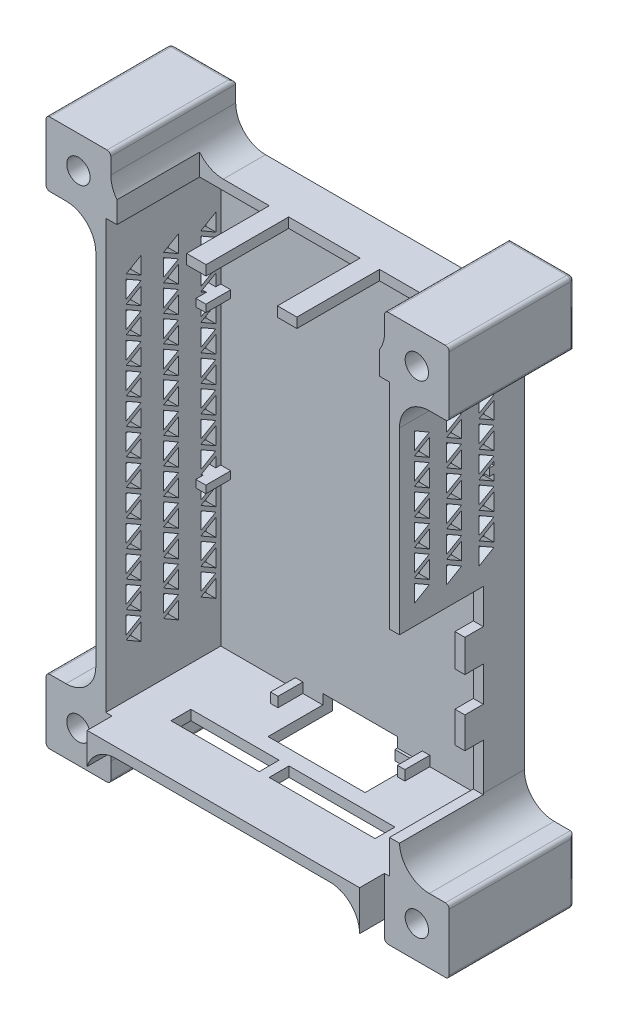
from build123d import *

# Parameters (mm, degrees)
SKETCH1_W            = 61
SKETCH1_H            = 90
BOSS_EXTRUDE1_DEPTH  = 2
SKETCH2_W            = 61
SKETCH2_H            = 90
SKETCH2_W_2          = 57
SKETCH2_H_2          = 86
BOSS_EXTRUDE2_DEPTH  = 6.6
SKETCH3_W            = 1.5
SKETCH3_H            = 2
SKETCH3_W_2          = 2
SKETCH3_H_2          = 1.5
BOSS_EXTRUDE3_DEPTH  = 5
SKETCH4_W            = 61
SKETCH4_H            = 90
SKETCH4_W_2          = 57
SKETCH4_H_2          = 86
BOSS_EXTRUDE4_DEPTH  = 16.5
SKETCH5_W            = 14.35
SKETCH5_H            = 16.6
SKETCH5_W_2          = 14
CUT_EXTRUDE1_DEPTH   = 2
SKETCH8_W            = 19.5
SKETCH8_H            = 10.5
SKETCH8_W_2          = 17.719958389
SKETCH8_H_2          = 4
SKETCH8_W_3          = 21.280041611
CUT_EXTRUDE3_DEPTH   = 2
CUT_EXTRUDE22_DEPTH  = 2
SKETCH10_W           = 61
SKETCH10_H           = 2
BOSS_EXTRUDE5_DEPTH  = 5
SKETCH20_W           = 13
SKETCH20_H           = 13
BOSS_EXTRUDE8_DEPTH  = 25.1
SKETCH25_W           = 13
SKETCH25_H           = 13
SKETCH25_W_2         = 0.25
CUT_EXTRUDE11_DEPTH  = 126.183904716
SKETCH26_W           = 1
SKETCH26_H           = 1
CUT_EXTRUDE12_DEPTH  = 23.1
SKETCH27_R           = 2.35
CUT_EXTRUDE13_DEPTH  = 126.183904716
CUT_EXTRUDE17_DEPTH  = 6
FILLET3_R            = 6
FILLET7_R            = 6
BOSS_EXTRUDE11_DEPTH = 25.1
SKETCH35_R           = 2.35
CUT_EXTRUDE18_DEPTH  = 126.183904716
FILLET10_R           = 6
FILLET13_R           = 0.75
CUT_EXTRUDE19_DEPTH  = 6
SKETCH38_W           = 11
SKETCH38_H           = 11
CUT_EXTRUDE20_DEPTH  = 10
FILLET14_R           = 6
SKETCH39_W           = 15
SKETCH39_H           = 2.5
CUT_EXTRUDE21_DEPTH  = 4
FILLET17_R           = 6
FILLET18_R           = 6
SKETCH43_W           = 3
SKETCH43_H           = 1.5
BOSS_EXTRUDE15_DEPTH = 2
CUT_EXTRUDE23_DEPTH  = 2
SKETCH44_W           = 0.9
SKETCH44_H           = 1.5
BOSS_EXTRUDE16_DEPTH = 2
FILLET19_R           = 6
FILLET20_R           = 6


with BuildPart() as part:
    # Sketch1 → Boss-Extrude1 (new body)
    with BuildSketch(Plane.XY):
        with Locations((30.5, 45)):
            Rectangle(SKETCH1_W, SKETCH1_H)
    extrude(amount=BOSS_EXTRUDE1_DEPTH)

    # Sketch2 → Boss-Extrude2 (add)
    with BuildSketch(Plane.XY.offset(2)):
        with Locations((30.5, 45)):
            Rectangle(SKETCH2_W, SKETCH2_H)
        with Locations((30.5, 45)):
            Rectangle(SKETCH2_W_2, SKETCH2_H_2, mode=Mode.SUBTRACT)
    extrude(amount=BOSS_EXTRUDE2_DEPTH)

    # Sketch3 → Boss-Extrude3 (add)
    with BuildSketch(Plane.XY.offset(2)):
        with Locations((43.25, 3)):
            Rectangle(SKETCH3_W, SKETCH3_H)
        with Locations((17.75, 3)):
            Rectangle(SKETCH3_W, SKETCH3_H)
        with Locations((3, 32.75)):
            Rectangle(SKETCH3_W_2, SKETCH3_H_2)
        with Locations((58, 32.75)):
            Rectangle(SKETCH3_W_2, SKETCH3_H_2)
        with Locations((58, 64.25)):
            Rectangle(SKETCH3_W_2, SKETCH3_H_2)
        with Locations((3, 64.25)):
            Rectangle(SKETCH3_W_2, SKETCH3_H_2)
    extrude(amount=BOSS_EXTRUDE3_DEPTH)

    # Sketch4 → Boss-Extrude4 (add)
    with BuildSketch(Plane.XY.offset(8.6)):
        with Locations((30.5, 45)):
            Rectangle(SKETCH4_W, SKETCH4_H)
        with Locations((30.5, 45)):
            Rectangle(SKETCH4_W_2, SKETCH4_H_2, mode=Mode.SUBTRACT)
    extrude(amount=BOSS_EXTRUDE4_DEPTH)

    # Sketch5 → Cut-Extrude1 (cut)
    with BuildSketch(Plane(origin=(0, 90, 0), x_dir=(1, 0, 0), z_dir=(0, 1, 0))):
        Polygon((57, -8.5), (40.4, -8.5), (40.4, -22.25), (40.4, -25.1), (57, -25.1), align=None)
        with Locations((29.325, -16.8)):
            Rectangle(SKETCH5_W, SKETCH5_H)
        with Locations((11.25, -16.8)):
            Rectangle(SKETCH5_W_2, SKETCH5_H)
    extrude(amount=-CUT_EXTRUDE1_DEPTH, mode=Mode.SUBTRACT)

    # Sketch8 → Cut-Extrude3 (cut)
    with BuildSketch(Plane(origin=(0, 0, 0), x_dir=(-1, 0, 0), z_dir=(0, -1, 0))):
        with Locations((-32.25, -7.75)):
            Rectangle(SKETCH8_W, SKETCH8_H)
        with Locations((-18.859979194, -18)):
            Rectangle(SKETCH8_W_2, SKETCH8_H_2)
        with Locations((-40.359979194, -18)):
            Rectangle(SKETCH8_W_3, SKETCH8_H_2)
    extrude(amount=-CUT_EXTRUDE3_DEPTH, mode=Mode.SUBTRACT)

    # Sketch9 → Cut-Extrude22 (cut)
    with BuildSketch(Plane.ZY):
        Polygon((3, 78), (6, 76.267949192), (3, 74.535898385), align=None)
        Polygon((3, 73.612137954), (6, 75.344188762), (6, 71.880087147), align=None)
        Polygon((10.5, 74.535898385), (10.5, 78), (13.5, 76.267949192), align=None)
        Polygon((13.5, 71.880087147), (10.5, 73.612137954), (13.5, 75.344188762), align=None)
        Polygon((18, 74.535898385), (18, 78), (21, 76.267949192), align=None)
        Polygon((21, 71.880087147), (18, 73.612137954), (21, 75.344188762), align=None)
        Polygon((10.5, 69.224275908), (10.5, 72.688377523), (13.5, 70.956326716), align=None)
        Polygon((13.5, 66.56846467), (10.5, 68.300515478), (13.5, 70.032566285), align=None)
        Polygon((18, 69.224275908), (18, 72.688377523), (21, 70.956326716), align=None)
        Polygon((21, 66.56846467), (18, 68.300515478), (21, 70.032566285), align=None)
        Polygon((10.5, 63.912653432), (10.5, 67.376755047), (13.5, 65.644704239), align=None)
        Polygon((13.5, 61.256842194), (10.5, 62.988893001), (13.5, 64.720943809), align=None)
        Polygon((18, 63.912653432), (18, 67.376755047), (21, 65.644704239), align=None)
        Polygon((21, 61.256842194), (18, 62.988893001), (21, 64.720943809), align=None)
        Polygon((10.5, 58.601030955), (10.5, 62.06513257), (13.5, 60.333081763), align=None)
        Polygon((13.5, 55.945219717), (10.5, 57.677270525), (13.5, 59.409321332), align=None)
        Polygon((18, 58.601030955), (18, 62.06513257), (21, 60.333081763), align=None)
        Polygon((21, 55.945219717), (18, 57.677270525), (21, 59.409321332), align=None)
        Polygon((10.5, 53.289408479), (10.5, 56.753510094), (13.5, 55.021459286), align=None)
        Polygon((13.5, 50.63359724), (10.5, 52.365648048), (13.5, 54.097698856), align=None)
        Polygon((18, 53.289408479), (18, 56.753510094), (21, 55.021459286), align=None)
        Polygon((21, 50.63359724), (18, 52.365648048), (21, 54.097698856), align=None)
        Polygon((10.5, 47.977786002), (10.5, 51.441887617), (13.5, 49.70983681), align=None)
        Polygon((13.5, 45.321974764), (10.5, 47.054025571), (13.5, 48.786076379), align=None)
        Polygon((18, 47.977786002), (18, 51.441887617), (21, 49.70983681), align=None)
        Polygon((21, 45.321974764), (18, 47.054025571), (21, 48.786076379), align=None)
        Polygon((10.5, 42.666163526), (10.5, 46.130265141), (13.5, 44.398214333), align=None)
        Polygon((13.5, 40.010352287), (10.5, 41.742403095), (13.5, 43.474453902), align=None)
        Polygon((18, 42.666163526), (18, 46.130265141), (21, 44.398214333), align=None)
        Polygon((21, 40.010352287), (18, 41.742403095), (21, 43.474453902), align=None)
        Polygon((10.5, 37.354541049), (10.5, 40.818642664), (13.5, 39.086591857), align=None)
        Polygon((13.5, 34.698729811), (10.5, 36.430780618), (13.5, 38.162831426), align=None)
        Polygon((18, 37.354541049), (18, 40.818642664), (21, 39.086591857), align=None)
        Polygon((21, 34.698729811), (18, 36.430780618), (21, 38.162831426), align=None)
        Polygon((10.5, 32.042918573), (10.5, 35.507020188), (13.5, 33.77496938), align=None)
        Polygon((13.5, 29.387107334), (10.5, 31.119158142), (13.5, 32.851208949), align=None)
        Polygon((18, 32.042918573), (18, 35.507020188), (21, 33.77496938), align=None)
        Polygon((21, 29.387107334), (18, 31.119158142), (21, 32.851208949), align=None)
        Polygon((10.5, 26.731296096), (10.5, 30.195397711), (13.5, 28.463346904), align=None)
        Polygon((13.5, 24.075484858), (10.5, 25.807535665), (13.5, 27.539586473), align=None)
        Polygon((18, 26.731296096), (18, 30.195397711), (21, 28.463346904), align=None)
        Polygon((21, 24.075484858), (18, 25.807535665), (21, 27.539586473), align=None)
        Polygon((10.5, 21.419673619), (10.5, 24.883775235), (13.5, 23.151724427), align=None)
        Polygon((13.5, 18.763862381), (10.5, 20.495913189), (13.5, 22.227963996), align=None)
        Polygon((18, 21.419673619), (18, 24.883775235), (21, 23.151724427), align=None)
        Polygon((21, 18.763862381), (18, 20.495913189), (21, 22.227963996), align=None)
        Polygon((10.5, 16.108051143), (10.5, 19.572152758), (13.5, 17.84010195), align=None)
        Polygon((13.5, 13.452239905), (10.5, 15.184290712), (13.5, 16.91634152), align=None)
        Polygon((18, 16.108051143), (18, 19.572152758), (21, 17.84010195), align=None)
        Polygon((21, 13.452239905), (18, 15.184290712), (21, 16.91634152), align=None)
        Polygon((10.5, 10.796428666), (10.5, 14.260530281), (13.5, 12.528479474), align=None)
        Polygon((18, 10.796428666), (18, 14.260530281), (21, 12.528479474), align=None)
        Polygon((3, 69.224275908), (3, 72.688377523), (6, 70.956326716), align=None)
        Polygon((6, 66.56846467), (3, 68.300515478), (6, 70.032566285), align=None)
        Polygon((3, 63.912653432), (3, 67.376755047), (6, 65.644704239), align=None)
        Polygon((6, 61.256842194), (3, 62.988893001), (6, 64.720943809), align=None)
        Polygon((3, 58.601030955), (3, 62.06513257), (6, 60.333081763), align=None)
        Polygon((6, 55.945219717), (3, 57.677270525), (6, 59.409321332), align=None)
        Polygon((3, 53.289408479), (3, 56.753510094), (6, 55.021459286), align=None)
        Polygon((6, 50.63359724), (3, 52.365648048), (6, 54.097698856), align=None)
        Polygon((3, 47.977786002), (3, 51.441887617), (6, 49.70983681), align=None)
        Polygon((6, 45.321974764), (3, 47.054025571), (6, 48.786076379), align=None)
        Polygon((3, 42.666163526), (3, 46.130265141), (6, 44.398214333), align=None)
        Polygon((6, 40.010352287), (3, 41.742403095), (6, 43.474453902), align=None)
        Polygon((3, 37.354541049), (3, 40.818642664), (6, 39.086591857), align=None)
        Polygon((6, 34.698729811), (3, 36.430780618), (6, 38.162831426), align=None)
        Polygon((3, 32.042918573), (3, 35.507020188), (6, 33.77496938), align=None)
        Polygon((6, 29.387107334), (3, 31.119158142), (6, 32.851208949), align=None)
        Polygon((3, 26.731296096), (3, 30.195397711), (6, 28.463346904), align=None)
        Polygon((6, 24.075484858), (3, 25.807535665), (6, 27.539586473), align=None)
        Polygon((3, 21.419673619), (3, 24.883775235), (6, 23.151724427), align=None)
        Polygon((6, 18.763862381), (3, 20.495913189), (6, 22.227963996), align=None)
        Polygon((3, 16.108051143), (3, 19.572152758), (6, 17.84010195), align=None)
        Polygon((6, 13.452239905), (3, 15.184290712), (6, 16.91634152), align=None)
        Polygon((3, 10.796428666), (3, 14.260530281), (6, 12.528479474), align=None)
    extrude(amount=-CUT_EXTRUDE22_DEPTH, mode=Mode.SUBTRACT)

    # Sketch10 → Boss-Extrude5 (add)
    with BuildSketch(Plane.XY.offset(25.1)):
        with Locations((30.5, 1)):
            Rectangle(SKETCH10_W, SKETCH10_H)
    extrude(amount=BOSS_EXTRUDE5_DEPTH)

    # Sketch20 → Boss-Extrude8 (add)
    with BuildSketch(Plane(origin=(0, 0, 0), x_dir=(-1, 0, 0), z_dir=(0, 0, -1))):
        with Locations((3.5, -3.5)):
            Rectangle(SKETCH20_W, SKETCH20_H)
        with Locations((-64.5, 93.5)):
            Rectangle(SKETCH20_W, SKETCH20_H)
    extrude(amount=-BOSS_EXTRUDE8_DEPTH)

    # Sketch25 → Cut-Extrude11 (cut, through all)
    with BuildSketch(Plane.XY.offset(25.1)):
        with Locations((-3.5, -3.5)):
            Rectangle(SKETCH25_W, SKETCH25_H)
        with Locations((3.125, -3.5)):
            Rectangle(SKETCH25_W_2, SKETCH25_H)
    extrude(amount=CUT_EXTRUDE11_DEPTH, mode=Mode.SUBTRACT)

    # Sketch26 → Cut-Extrude12 (cut)
    with BuildSketch(Plane.XY.offset(25.1)):
        with Locations((2.5, 2.5)):
            Rectangle(SKETCH26_W, SKETCH26_H)
        with Locations((58.5, 87.5)):
            Rectangle(SKETCH26_W, SKETCH26_H)
    extrude(amount=-CUT_EXTRUDE12_DEPTH, mode=Mode.SUBTRACT)

    # Sketch27 → Cut-Extrude13 (cut, through all)
    with BuildSketch(Plane.XY.offset(25.1)):
        with Locations((-3.5, -3.5)):
            Circle(SKETCH27_R)
        with Locations((64.5, 93.5)):
            Circle(SKETCH27_R)
    extrude(amount=-CUT_EXTRUDE13_DEPTH, mode=Mode.SUBTRACT)

    # Sketch31 → Cut-Extrude17 (cut)
    with BuildSketch(Plane(origin=(0, 0, 0), x_dir=(-1, 0, 0), z_dir=(0, 0, -1))):
        Polygon((-61.873056275, 88.95), (-59.24611255, 93.5), (-61.873056275, 98.05), (-67.126943725, 98.05), (-69.75388745, 93.5), (-67.126943725, 88.95), align=None)
        Polygon((6.126943725, -8.05), (8.75388745, -3.5), (6.126943725, 1.05), (0.873056275, 1.05), (-1.75388745, -3.5), (0.873056275, -8.05), align=None)
    extrude(amount=-CUT_EXTRUDE17_DEPTH, mode=Mode.SUBTRACT)

    # Fillet3
    fillet3_edges = [part.edges().sort_by_distance(p)[0] for p in [
        (58, 90, 12.55),
    ]]
    fillet(fillet3_edges, radius=FILLET3_R)

    # Fillet7
    fillet7_edges = [part.edges().sort_by_distance(p)[0] for p in [
        (3, 0, 12.55),
    ]]
    fillet(fillet7_edges, radius=FILLET7_R)

    # Sketch34 → Boss-Extrude11 (add)
    with BuildSketch(Plane.XY.offset(25.1)):
        Polygon((59, 3), (71, 3), (71, -10), (58, -10), (58, 2), (59, 2), align=None)
        Polygon((2, 87), (-10, 87), (-10, 100), (3, 100), (3, 88), (2, 88), align=None)
    extrude(amount=-BOSS_EXTRUDE11_DEPTH)

    # Sketch35 → Cut-Extrude18 (cut, through all)
    with BuildSketch(Plane.XY.offset(25.1)):
        with Locations((-3.5, 93.5)):
            Circle(SKETCH35_R)
        with Locations((64.5, -3.5)):
            Circle(SKETCH35_R)
    extrude(amount=-CUT_EXTRUDE18_DEPTH, mode=Mode.SUBTRACT)

    # Fillet10
    fillet10_edges = [part.edges().sort_by_distance(p)[0] for p in [
        (3, 90, 12.55),
    ]]
    fillet(fillet10_edges, radius=FILLET10_R)

    # Fillet13
    fillet13_edges = [part.edges().sort_by_distance(p)[0] for p in [
        (3, -10, 12.55),
        (-3.5, -10, 0),
        (-10, -3.5, 0),
        (-10, -10, 12.55),
        (-10, 3, 12.55),
        (58, 100, 12.55),
        (64.5, 100, 0),
        (71, 93.5, 0),
        (71, 100, 12.55),
        (71, 87, 12.55),
        (58, -10, 12.55),
        (64.5, -10, 0),
        (71, -10, 12.55),
        (71, -3.5, 0),
        (71, 3, 12.55),
        (3, 100, 12.55),
        (-3.5, 100, 0),
        (-10, 100, 12.55),
        (-10, 93.5, 0),
        (-10, 87, 12.55),
    ]]
    fillet(fillet13_edges, radius=FILLET13_R)

    # Sketch36 → Cut-Extrude19 (cut)
    with BuildSketch(Plane(origin=(0, 0, 0), x_dir=(-1, 0, 0), z_dir=(0, 0, -1))):
        Polygon((-59.24611255, -3.5), (-61.873056275, 1.05), (-67.126943725, 1.05), (-69.75388745, -3.5), (-67.126943725, -8.05), (-61.873056275, -8.05), align=None)
        Polygon((-1.75388745, 93.5), (0.873056275, 88.95), (6.126943725, 88.95), (8.75388745, 93.5), (6.126943725, 98.05), (0.873056275, 98.05), align=None)
    extrude(amount=-CUT_EXTRUDE19_DEPTH, mode=Mode.SUBTRACT)

    # Sketch38 → Cut-Extrude20 (cut)
    with BuildSketch(Plane.XY.offset(25.1)):
        with Locations((63.5, -2.5)):
            Rectangle(SKETCH38_W, SKETCH38_H)
    extrude(amount=CUT_EXTRUDE20_DEPTH, mode=Mode.SUBTRACT)

    # Fillet14
    # the kernel refuses this fillet: 6 mm, written as the material it adds along each edge
    with BuildSketch(Plane(origin=(58, 0, 40.1), x_dir=(0, -1, 0), z_dir=(0, 0, -1))) as fillet14_piece_1_section:
        with BuildLine():
            CenterArc((FILLET14_R, FILLET14_R), FILLET14_R, 180, 90)
            Line((0, FILLET14_R), (0, 0))
            Line((0, 0), (FILLET14_R, 0))
        make_face()
    fillet14_piece_1 = extrude(amount=40.1, mode=Mode.PRIVATE)
    fillet14_piece_1 = split(fillet14_piece_1, bisect_by=Plane(origin=(56.518293699, -1.220838778, 25.1), z_dir=(0, 0, 1)), keep=Keep.TOP, mode=Mode.PRIVATE)
    fillet14_piece_1 = split(fillet14_piece_1, bisect_by=Plane(origin=(58, -1.220838778, 27.6), z_dir=(-1, 0, 0)), keep=Keep.TOP, mode=Mode.PRIVATE)
    fillet14_piece_1 = split(fillet14_piece_1, bisect_by=Plane(origin=(56.518293699, -1.220838778, 30.1), z_dir=(0, 0, -1)), keep=Keep.TOP, mode=Mode.PRIVATE)
    add(fillet14_piece_1)
    with BuildSketch(Plane(origin=(58, 0, 25.1), x_dir=(0, -1, 0), z_dir=(0, 0, -1))) as fillet14_piece_2_section:
        with BuildLine():
            CenterArc((FILLET14_R, FILLET14_R), FILLET14_R, 180, 90)
            Line((0, FILLET14_R), (0, 0))
            Line((0, 0), (FILLET14_R, 0))
        make_face()
    fillet14_piece_2 = extrude(amount=25.1, mode=Mode.PRIVATE)
    fillet14_piece_2 = split(fillet14_piece_2, bisect_by=Plane(origin=(58, -1.220838778, 12.55), z_dir=(-1, 0, 0)), keep=Keep.TOP, mode=Mode.PRIVATE)
    add(fillet14_piece_2)

    # Sketch39 → Cut-Extrude21 (cut)
    with BuildSketch(Plane.XZ):
        with Locations((30, 1.25)):
            Rectangle(SKETCH39_W, SKETCH39_H)
    extrude(amount=-CUT_EXTRUDE21_DEPTH, mode=Mode.SUBTRACT)

    # Fillet17
    fillet17_edges = [part.edges().sort_by_distance(p)[0] for p in [
        (0, 87, 12.55),
    ]]
    fillet(fillet17_edges, radius=FILLET17_R)

    # Fillet18
    fillet18_edges = [part.edges().sort_by_distance(p)[0] for p in [
        (0, 3, 12.55),
    ]]
    fillet(fillet18_edges, radius=FILLET18_R)

    # Sketch43 → Boss-Extrude15 (add)
    with BuildSketch(Plane.ZY):
        with Locations((4.5, 32.75)):
            Rectangle(SKETCH43_W, SKETCH43_H)
        with Locations((4.5, 64.25)):
            Rectangle(SKETCH43_W, SKETCH43_H)
    extrude(amount=-BOSS_EXTRUDE15_DEPTH)

    # Sketch7 → Cut-Extrude23 (cut)
    with BuildSketch(Plane(origin=(61, 0, 0), x_dir=(0, 0, -1), z_dir=(1, 0, 0))):
        Polygon((-11.95, 18.25), (-11.95, 24.5), (-8.25, 24.5), (-8.25, 31.5), (-11.95, 31.5), (-11.95, 38), (-8.25, 38), (-8.25, 45), (-25.1, 45), (-25.1, 8.75), (-8.25, 8.75), (-8.25, 18.25), align=None)
        Polygon((-22.1, 79), (-19.1, 77.267949192), (-22.1, 75.535898385), align=None)
        Polygon((-22.1, 74.612137955), (-19.1, 76.344188762), (-19.1, 72.880087147), align=None)
        Polygon((-15.6, 75.535898385), (-15.6, 79), (-12.6, 77.267949192), align=None)
        Polygon((-12.6, 72.880087147), (-15.6, 74.612137955), (-12.6, 76.344188762), align=None)
        Polygon((-9.1, 75.535898385), (-9.1, 79), (-6.1, 77.267949192), align=None)
        Polygon((-6.1, 72.880087147), (-9.1, 74.612137955), (-6.1, 76.344188762), align=None)
        Polygon((-15.6, 70.22427591), (-15.6, 73.688377525), (-12.6, 71.956326717), align=None)
        Polygon((-12.6, 67.568464672), (-15.6, 69.30051548), (-12.6, 71.032566287), align=None)
        Polygon((-9.1, 70.22427591), (-9.1, 73.688377525), (-6.1, 71.956326717), align=None)
        Polygon((-6.1, 67.568464672), (-9.1, 69.30051548), (-6.1, 71.032566287), align=None)
        Polygon((-15.6, 64.912653435), (-15.6, 68.37675505), (-12.6, 66.644704242), align=None)
        Polygon((-12.6, 62.256842197), (-15.6, 63.988893005), (-12.6, 65.720943812), align=None)
        Polygon((-9.1, 64.912653435), (-9.1, 68.37675505), (-6.1, 66.644704242), align=None)
        Polygon((-6.1, 62.256842197), (-9.1, 63.988893005), (-6.1, 65.720943812), align=None)
        Polygon((-15.6, 59.601030959), (-15.6, 63.065132575), (-12.6, 61.333081767), align=None)
        Polygon((-12.6, 56.945219722), (-15.6, 58.677270529), (-12.6, 60.409321337), align=None)
        Polygon((-9.1, 59.601030959), (-9.1, 63.065132575), (-6.1, 61.333081767), align=None)
        Polygon((-6.1, 56.945219722), (-9.1, 58.677270529), (-6.1, 60.409321337), align=None)
        Polygon((-15.6, 54.289408484), (-15.6, 57.753510099), (-12.6, 56.021459292), align=None)
        Polygon((-12.6, 51.633597247), (-15.6, 53.365648054), (-12.6, 55.097698862), align=None)
        Polygon((-9.1, 54.289408484), (-9.1, 57.753510099), (-6.1, 56.021459292), align=None)
        Polygon((-6.1, 51.633597247), (-9.1, 53.365648054), (-6.1, 55.097698862), align=None)
        Polygon((-15.6, 48.977786009), (-15.6, 52.441887624), (-12.6, 50.709836817), align=None)
        Polygon((-9.1, 48.977786009), (-9.1, 52.441887624), (-6.1, 50.709836817), align=None)
        Polygon((-22.1, 70.22427591), (-22.1, 73.688377525), (-19.1, 71.956326717), align=None)
        Polygon((-19.1, 67.568464672), (-22.1, 69.30051548), (-19.1, 71.032566287), align=None)
        Polygon((-22.1, 64.912653435), (-22.1, 68.37675505), (-19.1, 66.644704242), align=None)
        Polygon((-19.1, 62.256842197), (-22.1, 63.988893005), (-19.1, 65.720943812), align=None)
        Polygon((-22.1, 59.601030959), (-22.1, 63.065132575), (-19.1, 61.333081767), align=None)
        Polygon((-19.1, 56.945219722), (-22.1, 58.677270529), (-19.1, 60.409321337), align=None)
        Polygon((-22.1, 54.289408484), (-22.1, 57.753510099), (-19.1, 56.021459292), align=None)
        Polygon((-19.1, 51.633597247), (-22.1, 53.365648054), (-19.1, 55.097698862), align=None)
        Polygon((-22.1, 48.977786009), (-22.1, 52.441887624), (-19.1, 50.709836817), align=None)
    extrude(amount=-CUT_EXTRUDE23_DEPTH, mode=Mode.SUBTRACT)

    # Sketch44 → Boss-Extrude16 (add)
    with BuildSketch(Plane(origin=(61, 0, 0), x_dir=(0, 0, -1), z_dir=(1, 0, 0))):
        with Locations((-6.55, 64.25)):
            Rectangle(SKETCH44_W, SKETCH44_H)
    extrude(amount=-BOSS_EXTRUDE16_DEPTH)

    # Fillet19
    fillet19_edges = [part.edges().sort_by_distance(p)[0] for p in [
        (61, 3, 12.55),
    ]]
    fillet(fillet19_edges, radius=FILLET19_R)

    # Fillet20
    fillet20_edges = [part.edges().sort_by_distance(p)[0] for p in [
        (61, 87, 12.55),
    ]]
    fillet(fillet20_edges, radius=FILLET20_R)


solid = part.part
